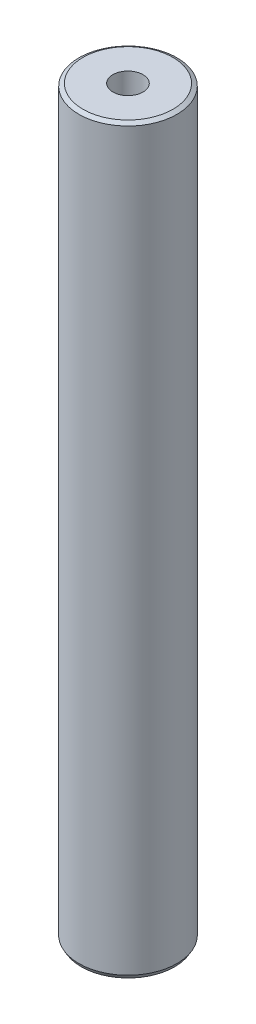
from build123d import *
from OCP.BRepFilletAPI import BRepFilletAPI_MakeChamfer

# Parameters (mm, degrees)
SKETCH1_R           = 35
BOSS_EXTRUDE1_DEPTH = 529.479482132
SKETCH2_R           = 10.769564276
CUT_EXTRUDE1_DEPTH  = 532.788042362
CHAMFER1_SIZE       = 1.667620133
CHAMFER1_SIZE2      = 2.888402798


with BuildPart() as part:
    # Sketch1 → Boss-Extrude1 (new body)
    with BuildSketch(Plane(origin=(0, 0, 0), x_dir=(1, 0, 0), z_dir=(0, 1, 0))):
        Circle(SKETCH1_R)
    extrude(amount=BOSS_EXTRUDE1_DEPTH)

    # Sketch2 → Cut-Extrude1 (cut, through all)
    with BuildSketch(Plane(origin=(0, 0, 0), x_dir=(1, 0, 0), z_dir=(0, 1, 0))):
        Circle(SKETCH2_R)
    extrude(amount=CUT_EXTRUDE1_DEPTH, mode=Mode.SUBTRACT)

    # Chamfer1: one chamfer whose edges measure the first distance from different faces: ONE call of the kernel's chamfer builder (chamfer() names one face for all edges)
    chamfer1_edges_1 = [part.edges().sort_by_distance(p)[0] for p in [
        (-35, 529.479482132, 0),
    ]]
    chamfer1_side_1 = [part.faces().sort_by_distance(p)[0] for p in [
        (-35, 264.739741066, 0),
    ]]
    chamfer1_edges_2 = [part.edges().sort_by_distance(p)[0] for p in [
        (-35, 0, 0),
    ]]
    chamfer1_side_2 = [part.faces().sort_by_distance(p)[0] for p in [
        (-34.010050506, 0, 0),
    ]]
    chamfer1 = BRepFilletAPI_MakeChamfer(part.part.solid().wrapped)
    for e in chamfer1_edges_1:
        chamfer1.Add(CHAMFER1_SIZE, CHAMFER1_SIZE2, e.wrapped, chamfer1_side_1[0].wrapped)  # the first distance lies on this face
    for e in chamfer1_edges_2:
        chamfer1.Add(CHAMFER1_SIZE, CHAMFER1_SIZE2, e.wrapped, chamfer1_side_2[0].wrapped)  # the first distance lies on this face
    add(Compound.cast(chamfer1.Shape()), mode=Mode.REPLACE)


solid = part.part
